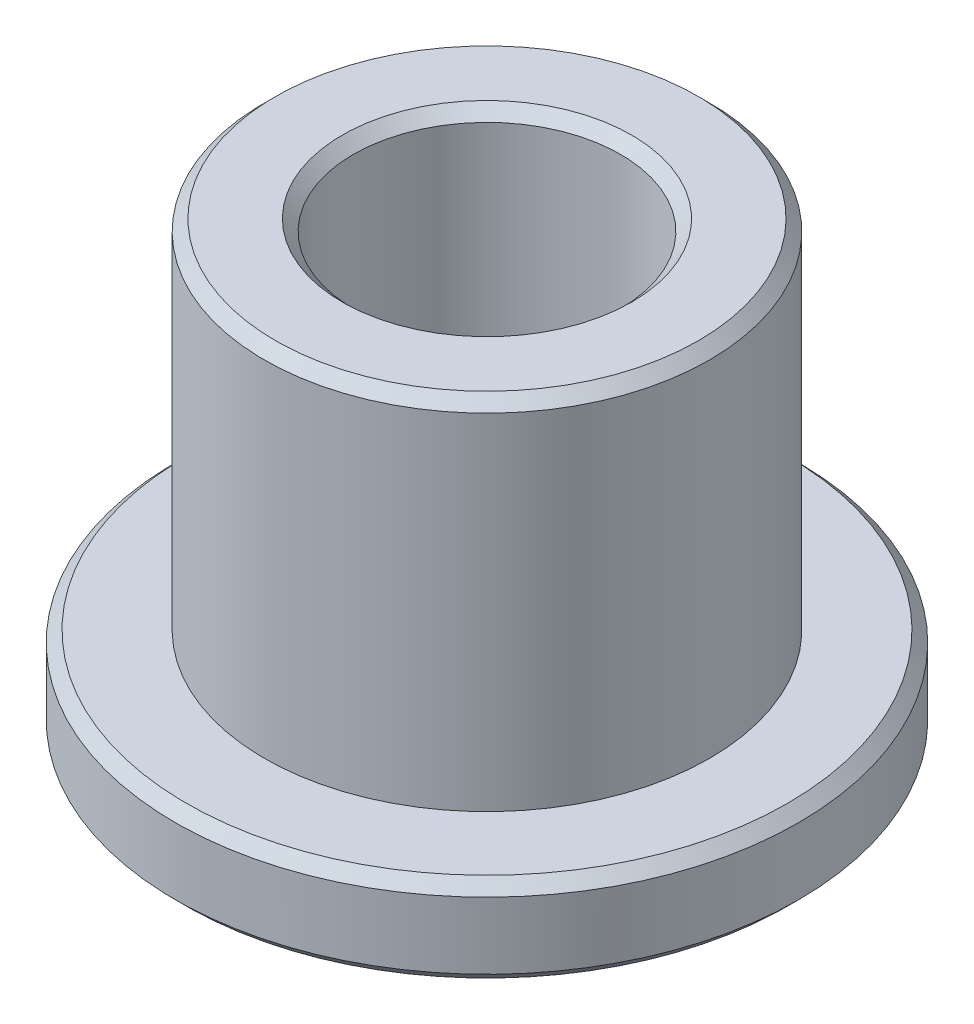
from build123d import *

# Parameters (mm, degrees)
CHAMFER1_SIZE = 0.25


with BuildPart() as part:
    # Sketch1 → Revolve1 (revolve)
    with BuildSketch(Plane.XY):
        Polygon((-3, 0), (-3, 10), (-5, 10), (-5, 2), (-7, 2), (-7, 0), align=None)
    revolve(axis=Axis((0, -356.558848917, 0), (0, 1, 0)))

    # Chamfer1
    chamfer1_edges = [part.edges().sort_by_distance(p)[0] for p in [
        (5, 10, 0),
        (3, 10, 0),
        (7, 0, 0),
        (7, 2, 0),
    ]]
    chamfer(chamfer1_edges, length=CHAMFER1_SIZE)


solid = part.part
